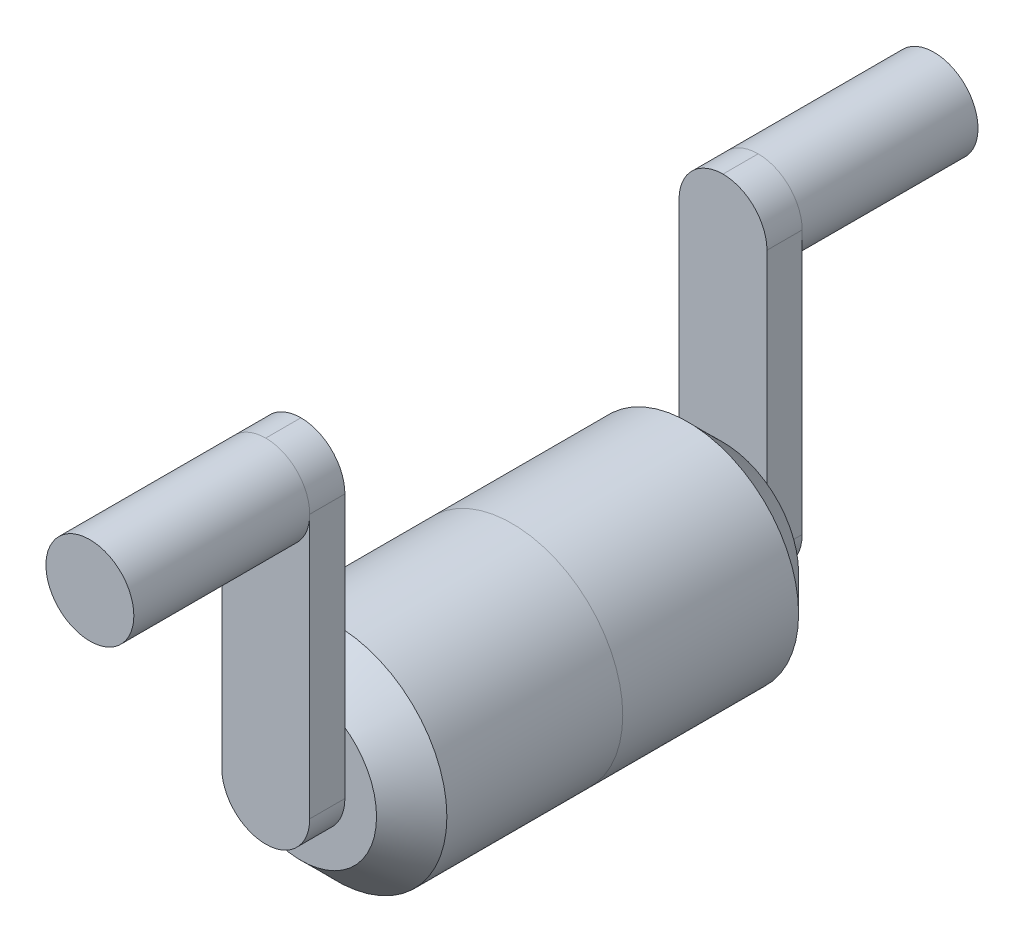
from build123d import *

# Parameters (mm, degrees)
SKETCH1_R           = 6.25
BOSS_EXTRUDE1_DEPTH = 30
SKETCH1_3_W         = 12.5
SKETCH1_3_H         = 50
BOSS_EXTRUDE2_DEPTH = 5
BOSS_EXTRUDE3_DEPTH = 30
CHAMFER1_SIZE       = 5
FILLET1_R           = 6.25


with BuildPart() as part:
    # Sketch1 → Boss-Extrude1 (new body)
    with BuildSketch(Plane.XY):
        Circle(SKETCH1_R)
    extrude(amount=BOSS_EXTRUDE1_DEPTH)

    # Sketch1<3> → Boss-Extrude2 (add)
    with BuildSketch(Plane.XY):
        with Locations((0, -18.75)):
            Rectangle(SKETCH1_3_W, SKETCH1_3_H)
    extrude(amount=BOSS_EXTRUDE2_DEPTH)

    # Fillet1
    fillet1_edges = [part.edges().sort_by_distance(p)[0] for p in [
        (-6.25, -43.75, 2.5),
        (-6.25, 6.25, 2.5),
        (6.25, -43.75, 2.5),
        (6.25, 6.25, 2.5),
    ]]
    fillet(fillet1_edges, radius=FILLET1_R - 0.0001)  # a hair under: the kernel refuses the full size


with BuildPart() as body_2:
    # Sketch1<4> → Boss-Extrude3 (new body)
    with BuildSketch(Plane.XY):
        with BuildLine():
            ThreePointArc((6.25, -23.043167705), (0, -21.75), (-6.25, -23.043167705))
            Line((-6.25, -23.043167705), (-6.25, -43.75))
            Line((-6.25, -43.75), (6.25, -43.75))
            Line((6.25, -43.75), (6.25, -23.043167705))
        make_face()
        with BuildLine():
            Line((-6.25, -43.75), (-6.25, -23.043167705))
            ThreePointArc((-6.25, -23.043167705), (-8.649421946, -50.662446581), (15.75, -37.5))
            ThreePointArc((15.75, -37.5), (13.162446581, -28.850578054), (6.25, -23.043167705))
            Line((6.25, -23.043167705), (6.25, -43.75))
            Line((6.25, -43.75), (-6.25, -43.75))
        make_face()
    extrude(amount=-BOSS_EXTRUDE3_DEPTH)

    # Chamfer1
    chamfer1_edges = [body_2.edges().sort_by_distance(p)[0] for p in [
        (-15.75, -37.5, 0),
    ]]
    chamfer(chamfer1_edges, length=CHAMFER1_SIZE)


with BuildPart() as body_3:
    # Mirror1: mirrored copy
    add(body_2.part.mirror(Plane(origin=(0, 0, -30), x_dir=(1, 0, 0), z_dir=(0, 0, -1))))


with BuildPart() as body_4:
    # Mirror1 2: mirrored copy
    add(part.part.mirror(Plane(origin=(0, 0, -30), x_dir=(1, 0, 0), z_dir=(0, 0, -1))))


solid = Compound([part.part, body_2.part, body_3.part, body_4.part])
